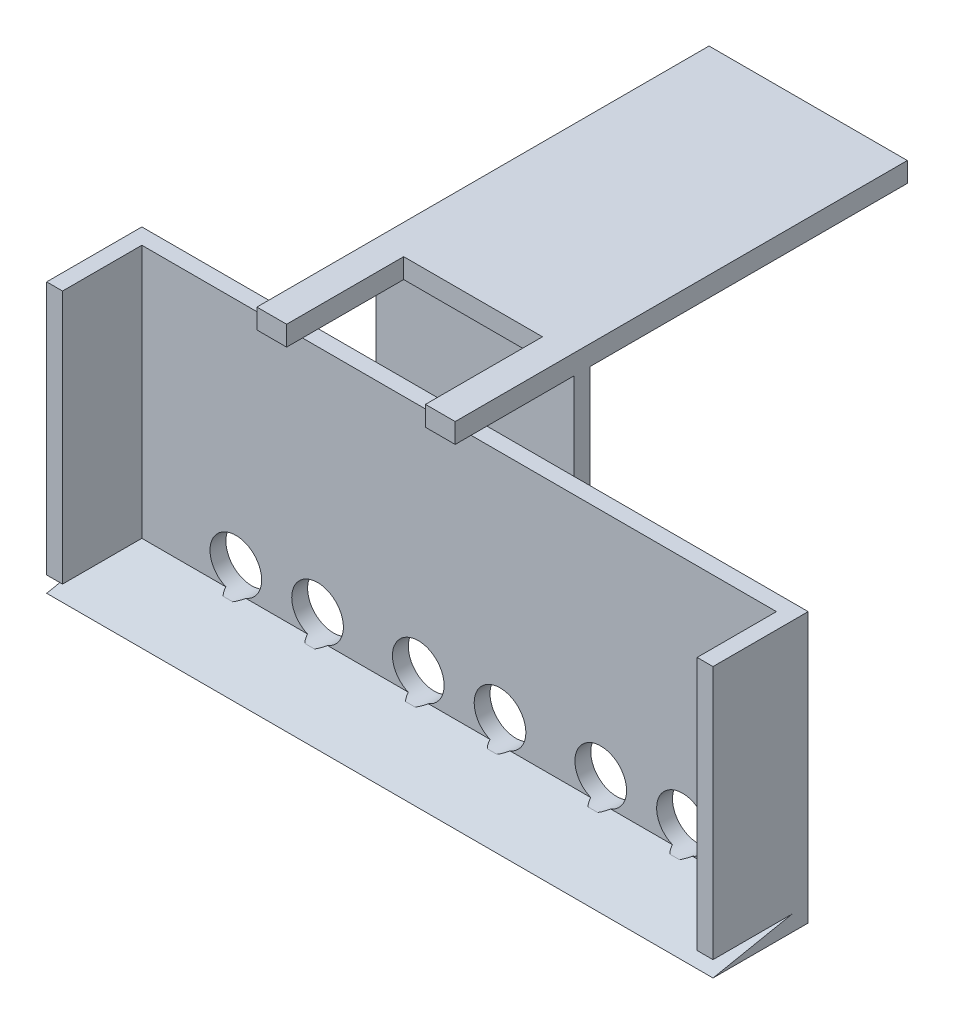
from build123d import *

# Parameters (mm, degrees)
SKETCH1_W               = 203.2
SKETCH1_H               = 25.4
BOSS_EXTRUDE1_DEPTH     = 5.08
BOSS_EXTRUDE2_DEPTH     = 5.08
SKETCH5_W               = 213.36
SKETCH5_H               = 86.36
BOSS_EXTRUDE3_DEPTH     = 5.08
CUT_EXTRUDE2_DEPTH      = 231.860710386
SKETCH7_W               = 63.5
SKETCH7_H               = 63.5
BOSS_EXTRUDE4_DEPTH     = 5.08
BOSS_EXTRUDE5_DEPTH     = 6.35
CUT_EXTRUDE3_REACH      = 205.537
SKETCH9_W               = 44.45
SKETCH9_H               = 58.324999377
CUT_EXTRUDE4_DEPTH      = 2.54
CUT_EXTRUDE4_DEPTH_BACK = 197.028932814
SKETCH10_R              = 8.2696685


with BuildPart() as part:
    # Sketch1 → Boss-Extrude1 (new body)
    with BuildSketch(Plane(origin=(0, 0, 0), x_dir=(1, 0, 0), z_dir=(0, 1, 0))):
        Rectangle(SKETCH1_W, SKETCH1_H)
    extrude(amount=BOSS_EXTRUDE1_DEPTH)

    # Sketch4 → Boss-Extrude2 (add)
    with BuildSketch(Plane(origin=(101.6, 0, 0), x_dir=(0, 0, -1), z_dir=(1, 0, 0))):
        Polygon((-12.7, 0), (-12.7, 5.08), (-12.7, 86.36), (12.7, 86.36), (12.7, 5.08), (12.7, 0), align=None)
    boss_extrude2 = extrude(amount=BOSS_EXTRUDE2_DEPTH)

    # Mirror1: Boss-Extrude2 across plane
    add(boss_extrude2.mirror(Plane(origin=(0, 0, 0), x_dir=(0, 0, 1), z_dir=(1, 0, 0))))

    # Sketch5 → Boss-Extrude3 (add)
    with BuildSketch(Plane(origin=(0, 0, -12.7), x_dir=(-1, 0, 0), z_dir=(0, 0, -1))):
        with Locations((0, 43.18)):
            Rectangle(SKETCH5_W, SKETCH5_H)
    extrude(amount=BOSS_EXTRUDE3_DEPTH)

    # Sketch6 → Cut-Extrude2 (cut, through all)
    with BuildSketch(Plane(origin=(106.68, 0, 0), x_dir=(0, 0, -1), z_dir=(1, 0, 0))):
        Polygon((-12.7, 0), (12.7, 5.08), (-12.7, 5.08), align=None)
    extrude(amount=-CUT_EXTRUDE2_DEPTH, mode=Mode.SUBTRACT)

    # Sketch7 → Boss-Extrude4 (add)
    with BuildSketch(Plane(origin=(0, 0, -17.78), x_dir=(-1, 0, 0), z_dir=(0, 0, -1))):
        with Locations((0, 82.55)):
            Rectangle(SKETCH7_W, SKETCH7_H)
    extrude(amount=BOSS_EXTRUDE4_DEPTH)

    # Sketch8 → Boss-Extrude5 (add)
    with BuildSketch(Plane(origin=(0, 114.3, 0), x_dir=(1, 0, 0), z_dir=(0, 1, 0))):
        Polygon((-31.75, 22.86), (-31.75, 124.46), (31.75, 124.46), (31.75, 22.86), (31.75, 17.78), (31.75, -20.32), (-31.75, -20.32), (-31.75, 17.78), align=None)
    extrude(amount=BOSS_EXTRUDE5_DEPTH)

    # Sketch9 → Cut-Extrude3 (cut, up to next)
    with BuildSketch(Plane(origin=(0, 120.65, 0), x_dir=(1, 0, 0), z_dir=(0, 1, 0)), mode=Mode.PRIVATE) as cut_extrude3_sk1:
        with Locations((0, -12.001142466)):
            Rectangle(SKETCH9_W, SKETCH9_H)
    cut_extrude3_tool1 = extrude(cut_extrude3_sk1.sketch, amount=-CUT_EXTRUDE3_REACH, mode=Mode.PRIVATE) & part.part
    add(cut_extrude3_tool1.solids().sort_by_distance((0, 120.65, 12.001142))[0], mode=Mode.SUBTRACT)

    # Sketch10 → Cut-Extrude4 (cut, two sides: drawn at the far end of the back side and taken through both)
    with BuildSketch(Plane.XY.offset(-12.7).offset(-CUT_EXTRUDE4_DEPTH_BACK)):
        with Locations((-13.081, 12.7)):
            Circle(SKETCH10_R)
        with Locations((13.081, 12.7)):
            Circle(SKETCH10_R)
        with Locations((-71.501, 12.7)):
            Circle(SKETCH10_R)
        with Locations((-45.339, 12.7)):
            Circle(SKETCH10_R)
        with Locations((45.339, 12.7)):
            Circle(SKETCH10_R)
        with Locations((71.501, 12.7)):
            Circle(SKETCH10_R)
    extrude(amount=CUT_EXTRUDE4_DEPTH + CUT_EXTRUDE4_DEPTH_BACK, mode=Mode.SUBTRACT)


solid = part.part
